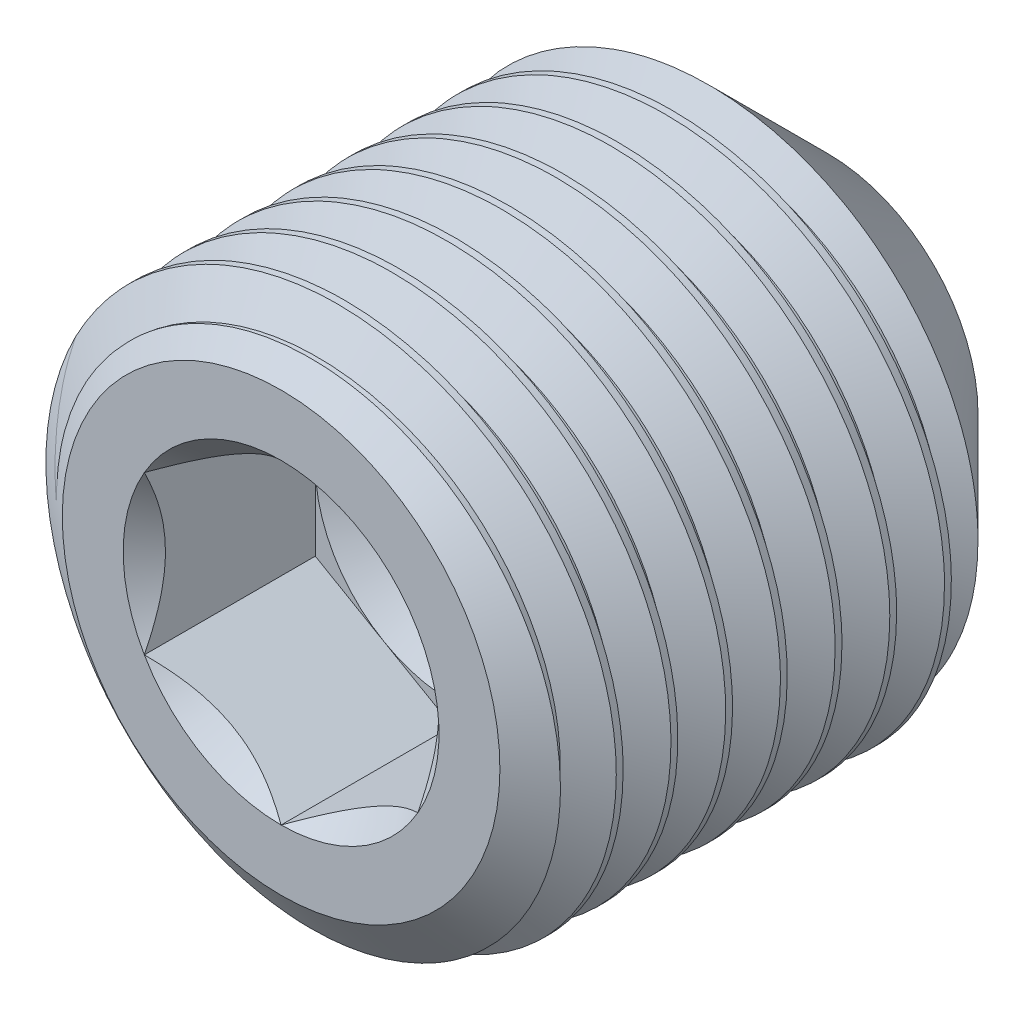
from build123d import *

# Parameters (mm, degrees)
CUT_SWEEP2_PITCH    = 1.27
CUT_EXTRUDE10_DEPTH = 3.96875


with BuildPart() as part:
    # Sketch22 → Revolve1 (revolve)
    with BuildSketch(Plane(origin=(0, 0, 0), x_dir=(0, 0, -1), z_dir=(1, 0, 0)), mode=Mode.PRIVATE) as revolve1_sk:
        Polygon((-5.304629558, 0), (-5.304629558, 5.08), (-4.415365985, 6.35), (4.524947597, 6.35), (7.395370442, 3.479577155), (5.304629558, 0), align=None)
    revolve(revolve1_sk.sketch.rotate(Axis((0, 0, -5.304629558), (0, 0, -1)), 180), axis=Axis((0, 0, -5.304629558), (0, 0, -1)))

    # Cut-Sweep2: the profile of Sketch28 profile screwed along a right-hand helix of 11 turns, 8 arcs to a turn; built about Z, then put on its axis
    cut_sweep2_z = Axis((0, 0, 0), (0, 0, 1))
    cut_sweep2_corners = [(6.3503, 0, 0.000173205), (6.3503, 0, -1.111423205), (5.525110803, 0, -0.635), (5.525110803, 0, -0.47625)]
    with BuildLine(mode=Mode.PRIVATE) as cut_sweep2_profile:
        Line(cut_sweep2_corners[0], cut_sweep2_corners[1])
        Line(cut_sweep2_corners[1], cut_sweep2_corners[2])
        Line(cut_sweep2_corners[2], cut_sweep2_corners[3])
        Line(cut_sweep2_corners[3], cut_sweep2_corners[0])
    cut_sweep2_cap = Face(cut_sweep2_profile.wire())
    cut_sweep2_turn_angles = [0, 22.5, 45, 67.5, 90, 112.5, 135, 157.5, 180, 202.5, 225, 247.5, 270, 292.5, 315, 337.5, 360]
    cut_sweep2_turn_weights = [1, 0.9238795325112867, 1, 0.9238795325112867, 1, 0.9238795325112867, 1, 0.9238795325112867, 1, 0.9238795325112867, 1, 0.9238795325112867, 1, 0.9238795325112867, 1, 0.9238795325112867, 1]
    cut_sweep2_turn_rails = [Edge.make_bspline([Vector(p[0], p[1], 0).rotate(cut_sweep2_z, cut_sweep2_turn_angles[k]) / cut_sweep2_turn_weights[k] + Vector(0, 0, p[2] + CUT_SWEEP2_PITCH * cut_sweep2_turn_angles[k] / 360) for k in range(17)], [0, 0, 0, 1, 1, 2, 2, 3, 3, 4, 4, 5, 5, 6, 6, 7, 7, 8, 8, 8], 2, cut_sweep2_turn_weights) for p in cut_sweep2_corners]
    cut_sweep2_turn_sides = [Face.make_surface_from_curves(cut_sweep2_turn_rails[p[0]], cut_sweep2_turn_rails[p[1]]) for p in [(0, 1), (1, 2), (2, 3), (3, 0)]]
    cut_sweep2 = Plane(origin=(0, 0, -7.395370442), x_dir=(0, 1, 0), z_dir=(0, 0, 1)) * Solid(Shell([*[p.moved(Location((0, 0, CUT_SWEEP2_PITCH * i))) for i in range(11) for p in cut_sweep2_turn_sides], cut_sweep2_cap, cut_sweep2_cap.rotate(cut_sweep2_z, 3960).moved(Location((0, 0, CUT_SWEEP2_PITCH * 3960 / 360)))]))
    add(cut_sweep2, mode=Mode.SUBTRACT)

    # Sketch23 → Cut-Extrude10 (cut)
    with BuildSketch(Plane.XY.offset(5.304629558)):
        Polygon((0, 3.666174209), (-3.175, 1.833087105), (-3.175, -1.833087105), (0, -3.666174209), (3.175, -1.833087105), (3.175, 1.833087105), align=None)
    extrude(amount=-CUT_EXTRUDE10_DEPTH, mode=Mode.SUBTRACT)

    # Cut-Extrude11 cone 1 section (through the dimple's axis) → Cut-Extrude11 (revolve, cut)
    with BuildSketch(Plane(origin=(0, 0, 5.304629558), x_dir=(0, -1, 0), z_dir=(1, 0, 0))):
        Polygon((0, 0), (3.666174209, 0), (0, 3.666174209), align=None)
    revolve(axis=Axis((0, 0, 5.304629558), (0, 0, -1)), mode=Mode.SUBTRACT)

    # Cut-Extrude12 cone 1 section (through the dimple's axis) → Cut-Extrude12 (revolve, cut)
    with BuildSketch(Plane(origin=(0, 0, 1.335879558), x_dir=(0, -1, 0), z_dir=(1, 0, 0))):
        Polygon((0, 0), (3.175, 0), (0, 1.833087105), align=None)
    revolve(axis=Axis((0, 0, 1.335879558), (0, 0, -1)), mode=Mode.SUBTRACT)


solid = part.part
